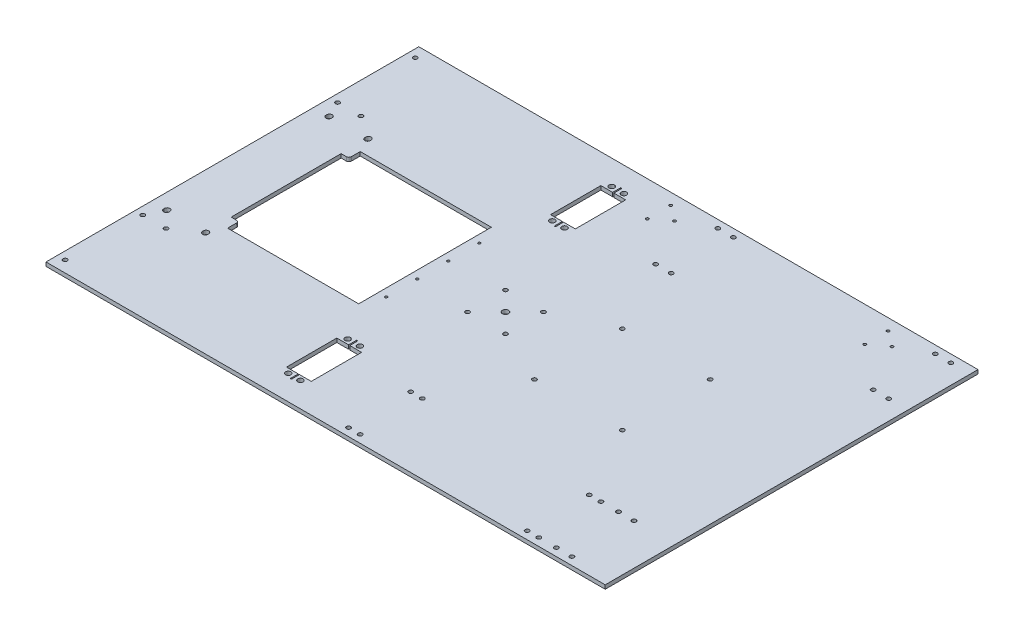
from build123d import *

# Parameters (mm, degrees)
SKETCH1_W           = 457.2
SKETCH1_H           = 304.8
BOSS_EXTRUDE1_DEPTH = 3.175
CUT_EXTRUDE1_DEPTH  = 275.761352131
CUT_EXTRUDE2_REACH  = 276.761
SKETCH5_R           = 1.700000029
CUT_EXTRUDE3_DEPTH  = 275.761352131
SKETCH7_R           = 2.200000045
CUT_EXTRUDE5_DEPTH  = 275.761352131
SKETCH8_R           = 1.000000032
CUT_EXTRUDE6_DEPTH  = 275.761352131
SKETCH12_R          = 1.700000029
CUT_EXTRUDE7_DEPTH  = 275.761352131
SKETCH13_R          = 1.700000029
SKETCH13_R_2        = 1.127000032
CUT_EXTRUDE8_DEPTH  = 275.761352131
SKETCH14_R          = 1.700000029
SKETCH14_R_2        = 2.499999953
CUT_EXTRUDE9_DEPTH  = 275.761352131


with BuildPart() as part:
    # Sketch1 → Boss-Extrude1 (new body)
    with BuildSketch(Plane(origin=(0, 0, 0), x_dir=(1, 0, 0), z_dir=(0, 1, 0))):
        Rectangle(SKETCH1_W, SKETCH1_H)
    extrude(amount=BOSS_EXTRUDE1_DEPTH)

    # Sketch2 → Cut-Extrude1 (cut, through all)
    with BuildSketch(Plane(origin=(0, 3.175, 0), x_dir=(1, 0, 0), z_dir=(0, 1, 0))):
        with BuildLine():
            Line((-218.100000045, 66.04), (-218.100000045, 66.675))
            ThreePointArc((-218.100000045, 66.675), (-215.9, 68.875000045), (-213.699999955, 66.675))
            Line((-213.699999955, 66.675), (-213.699999955, 66.04))
            ThreePointArc((-213.699999955, 66.04), (-215.9, 63.839999955), (-218.100000045, 66.04))
        make_face()
        with BuildLine():
            Line((-186.350000045, 66.04), (-186.350000045, 66.675))
            ThreePointArc((-186.350000045, 66.675), (-184.15, 68.875000045), (-181.949999955, 66.675))
            Line((-181.949999955, 66.675), (-181.949999955, 66.04))
            ThreePointArc((-181.949999955, 66.04), (-184.15, 63.839999955), (-186.350000045, 66.04))
        make_face()
        with BuildLine():
            Line((-213.699999955, -66.04), (-213.699999955, -66.675))
            ThreePointArc((-213.699999955, -66.675), (-215.9, -68.875000045), (-218.100000045, -66.675))
            Line((-218.100000045, -66.675), (-218.100000045, -66.04))
            ThreePointArc((-218.100000045, -66.04), (-215.9, -63.839999955), (-213.699999955, -66.04))
        make_face()
        with BuildLine():
            Line((-181.949999955, -66.04), (-181.949999955, -66.675))
            ThreePointArc((-181.949999955, -66.675), (-184.15, -68.875000045), (-186.350000045, -66.675))
            Line((-186.350000045, -66.675), (-186.350000045, -66.04))
            ThreePointArc((-186.350000045, -66.04), (-184.15, -63.839999955), (-181.949999955, -66.04))
        make_face()
    extrude(amount=-CUT_EXTRUDE1_DEPTH, mode=Mode.SUBTRACT)

    # Sketch4 → Cut-Extrude2 (cut, up to next)
    with BuildSketch(Plane(origin=(0, 3.175, 0), x_dir=(1, 0, 0), z_dir=(0, 1, 0)), mode=Mode.PRIVATE) as cut_extrude2_sk1:
        with BuildLine():
            Line((-184.658, 44.958), (-184.658, -44.958))
            Line((-184.658, -44.958), (-180.34, -44.958))
            ThreePointArc((-180.34, -44.958), (-178.903159021, -45.553159021), (-178.308, -46.99))
            Line((-178.308, -46.99), (-178.308, -54.229))
            Line((-178.308, -54.229), (-71.12, -54.229))
            Line((-71.12, -54.229), (-71.12, 54.229))
            Line((-71.12, 54.229), (-178.308, 54.229))
            Line((-178.308, 54.229), (-178.308, 46.99))
            ThreePointArc((-178.308, 46.99), (-178.903159021, 45.553159021), (-180.34, 44.958))
            Line((-180.34, 44.958), (-184.658, 44.958))
        make_face()
    cut_extrude2_tool1 = extrude(cut_extrude2_sk1.sketch, amount=-CUT_EXTRUDE2_REACH, mode=Mode.PRIVATE) & part.part
    add(cut_extrude2_tool1.solids().sort_by_distance((-127.379078, 3.175, 0))[0], mode=Mode.SUBTRACT)

    # Sketch5 → Cut-Extrude3 (cut, through all)
    with BuildSketch(Plane(origin=(0, 3.175, 0), x_dir=(1, 0, 0), z_dir=(0, 1, 0))):
        with Locations((-203.2, 79.629)):
            Circle(SKETCH5_R)
        with Locations((-222.25, 143.129)):
            Circle(SKETCH5_R)
        with Locations((-222.25, 79.629)):
            Circle(SKETCH5_R)
        with Locations((-203.2, -79.629)):
            Circle(SKETCH5_R)
        with Locations((-222.25, -79.629)):
            Circle(SKETCH5_R)
        with Locations((-222.25, -143.129)):
            Circle(SKETCH5_R)
    extrude(amount=-CUT_EXTRUDE3_DEPTH, mode=Mode.SUBTRACT)

    # Sketch7 → Cut-Extrude5 (cut, through all)
    with BuildSketch(Plane(origin=(0, 3.175, 0), x_dir=(1, 0, 0), z_dir=(0, 1, 0))):
        with Locations((-50.720000033, -132.250000041)):
            Circle(SKETCH7_R)
        with Locations((-40.719999967, -132.250000041)):
            Circle(SKETCH7_R)
        with Locations((-50.720000033, -83.649999959)):
            Circle(SKETCH7_R)
        with Locations((-40.719999967, -83.649999959)):
            Circle(SKETCH7_R)
        Polygon((-55.846999939, -87.373000006), (-46.22, -87.373000006), (-46.22, -80.769000006), (-45.22, -80.769000006), (-45.22, -87.373000006), (-35.593000061, -87.373000006), (-35.593000061, -128.526999994), (-45.22, -128.526999994), (-45.22, -135.130999994), (-46.22, -135.130999994), (-46.22, -128.526999994), (-55.846999939, -128.526999994), align=None)
    cut_extrude5 = extrude(amount=-CUT_EXTRUDE5_DEPTH, mode=Mode.SUBTRACT)

    # Mirror1: Cut-Extrude5 across plane
    add(cut_extrude5.mirror(Plane.XY), mode=Mode.SUBTRACT)

    # Sketch8 → Cut-Extrude6 (cut, through all)
    with BuildSketch(Plane(origin=(0, 3.175, 0), x_dir=(1, 0, 0), z_dir=(0, 1, 0))):
        with Locations((-64.77, -38.1)):
            Circle(SKETCH8_R)
        with Locations((-64.77, -12.7)):
            Circle(SKETCH8_R)
        with Locations((-64.77, 12.7)):
            Circle(SKETCH8_R)
        with Locations((-64.77, 38.1)):
            Circle(SKETCH8_R)
    extrude(amount=-CUT_EXTRUDE6_DEPTH, mode=Mode.SUBTRACT)

    # Sketch12 → Cut-Extrude7 (cut, through all)
    with BuildSketch(Plane(origin=(0, 3.175, 0), x_dir=(1, 0, 0), z_dir=(0, 1, 0))):
        with Locations((195.024, -95.25)):
            Circle(SKETCH12_R)
        with Locations((182.324, -95.25)):
            Circle(SKETCH12_R)
        with Locations((195.024, -146.05)):
            Circle(SKETCH12_R)
        with Locations((182.324, -146.05)):
            Circle(SKETCH12_R)
        with Locations((167.9575, -95.25)):
            Circle(SKETCH12_R)
        with Locations((158.4325, -95.25)):
            Circle(SKETCH12_R)
        with Locations((167.9575, -146.05)):
            Circle(SKETCH12_R)
        with Locations((158.4325, -146.05)):
            Circle(SKETCH12_R)
        with Locations((21.907498874, -146.049998946)):
            Circle(SKETCH12_R)
        with Locations((12.382498874, -146.049998946)):
            Circle(SKETCH12_R)
        with Locations((12.382498874, -95.249998946)):
            Circle(SKETCH12_R)
        with Locations((21.907498874, -95.249998946)):
            Circle(SKETCH12_R)
    extrude(amount=-CUT_EXTRUDE7_DEPTH, mode=Mode.SUBTRACT)

    # Sketch13 → Cut-Extrude8 (cut, through all)
    with BuildSketch(Plane(origin=(0, 3.175, 0), x_dir=(1, 0, 0), z_dir=(0, 1, 0))):
        with Locations((212.725, 95.25)):
            Circle(SKETCH13_R)
        with Locations((212.725, 146.05)):
            Circle(SKETCH13_R)
        with Locations((200.025, 95.25)):
            Circle(SKETCH13_R)
        with Locations((200.025, 146.05)):
            Circle(SKETCH13_R)
        with Locations((177.213, 133.477000026)):
            Circle(SKETCH13_R_2)
        with Locations((164.513, 143.002000026)):
            Circle(SKETCH13_R_2)
        with Locations((164.513, 123.952000026)):
            Circle(SKETCH13_R_2)
        with Locations((34.925, 95.25)):
            Circle(SKETCH13_R)
        with Locations((34.925, 146.05)):
            Circle(SKETCH13_R)
        with Locations((22.225, 95.25)):
            Circle(SKETCH13_R)
        with Locations((22.225, 146.05)):
            Circle(SKETCH13_R)
        with Locations((-0.587, 133.477000026)):
            Circle(SKETCH13_R_2)
        with Locations((-13.287, 143.002000026)):
            Circle(SKETCH13_R_2)
        with Locations((-13.287, 123.952000026)):
            Circle(SKETCH13_R_2)
    extrude(amount=-CUT_EXTRUDE8_DEPTH, mode=Mode.SUBTRACT)

    # Sketch14 → Cut-Extrude9 (cut, through all)
    with BuildSketch(Plane(origin=(0, 3.175, 0), x_dir=(1, 0, 0), z_dir=(0, 1, 0))):
        with Locations((54.248975516, 35.921024484)):
            Circle(SKETCH14_R)
        with Locations((126.091024484, 35.921024484)):
            Circle(SKETCH14_R)
        with Locations((54.248975516, -35.921024484)):
            Circle(SKETCH14_R)
        with Locations((126.091024484, -35.921024484)):
            Circle(SKETCH14_R)
        with Locations((-20.833999988, 15.499999988)):
            Circle(SKETCH14_R)
        with Locations((10.165999988, 15.499999988)):
            Circle(SKETCH14_R)
        with Locations((-20.833999988, -15.499999988)):
            Circle(SKETCH14_R)
        with Locations((10.165999988, -15.499999988)):
            Circle(SKETCH14_R)
        with Locations((-5.334, 0)):
            Circle(SKETCH14_R_2)
    extrude(amount=-CUT_EXTRUDE9_DEPTH, mode=Mode.SUBTRACT)


solid = part.part
